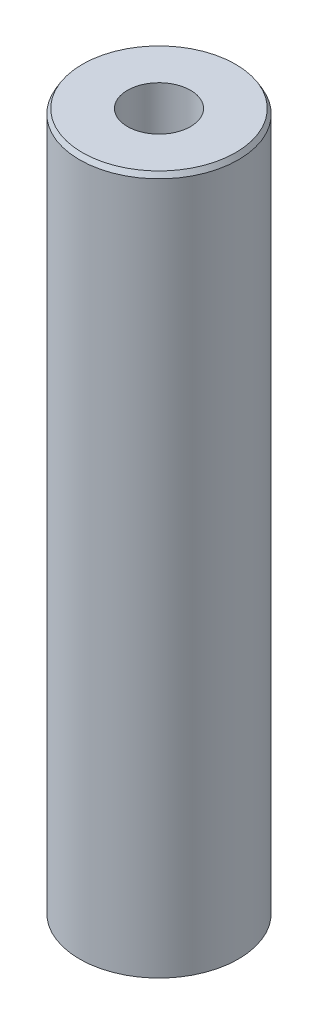
from build123d import *
from OCP.BRepFilletAPI import BRepFilletAPI_MakeChamfer

# Parameters (mm, degrees)
SKETCH1_R           = 47.5
BOSS_EXTRUDE1_DEPTH = 418.697580881
SKETCH2_R           = 18.861964559
CUT_EXTRUDE1_DEPTH  = 425.052077269
CHAMFER1_SIZE       = 2.887868222
CHAMFER1_SIZE2      = 1.667311495


with BuildPart() as part:
    # Sketch1 → Boss-Extrude1 (new body)
    with BuildSketch(Plane(origin=(0, 0, 0), x_dir=(1, 0, 0), z_dir=(0, 1, 0))):
        Circle(SKETCH1_R)
    extrude(amount=BOSS_EXTRUDE1_DEPTH)

    # Sketch2 → Cut-Extrude1 (cut, through all)
    with BuildSketch(Plane(origin=(0, 0, 0), x_dir=(1, 0, 0), z_dir=(0, 1, 0))):
        Circle(SKETCH2_R)
    extrude(amount=CUT_EXTRUDE1_DEPTH, mode=Mode.SUBTRACT)

    # Chamfer1: one chamfer whose edges measure the first distance from different faces: ONE call of the kernel's chamfer builder (chamfer() names one face for all edges)
    chamfer1_edges_1 = [part.edges().sort_by_distance(p)[0] for p in [
        (-47.5, 418.697580881, 0),
    ]]
    chamfer1_side_1 = [part.faces().sort_by_distance(p)[0] for p in [
        (-47.5, 209.348790441, 0),
    ]]
    chamfer1_edges_2 = [part.edges().sort_by_distance(p)[0] for p in [
        (-47.5, 0, 0),
    ]]
    chamfer1_side_2 = [part.faces().sort_by_distance(p)[0] for p in [
        (-46.156497116, 0, 0),
    ]]
    chamfer1 = BRepFilletAPI_MakeChamfer(part.part.solid().wrapped)
    for e in chamfer1_edges_1:
        chamfer1.Add(CHAMFER1_SIZE, CHAMFER1_SIZE2, e.wrapped, chamfer1_side_1[0].wrapped)  # the first distance lies on this face
    for e in chamfer1_edges_2:
        chamfer1.Add(CHAMFER1_SIZE, CHAMFER1_SIZE2, e.wrapped, chamfer1_side_2[0].wrapped)  # the first distance lies on this face
    add(Compound.cast(chamfer1.Shape()), mode=Mode.REPLACE)


solid = part.part
